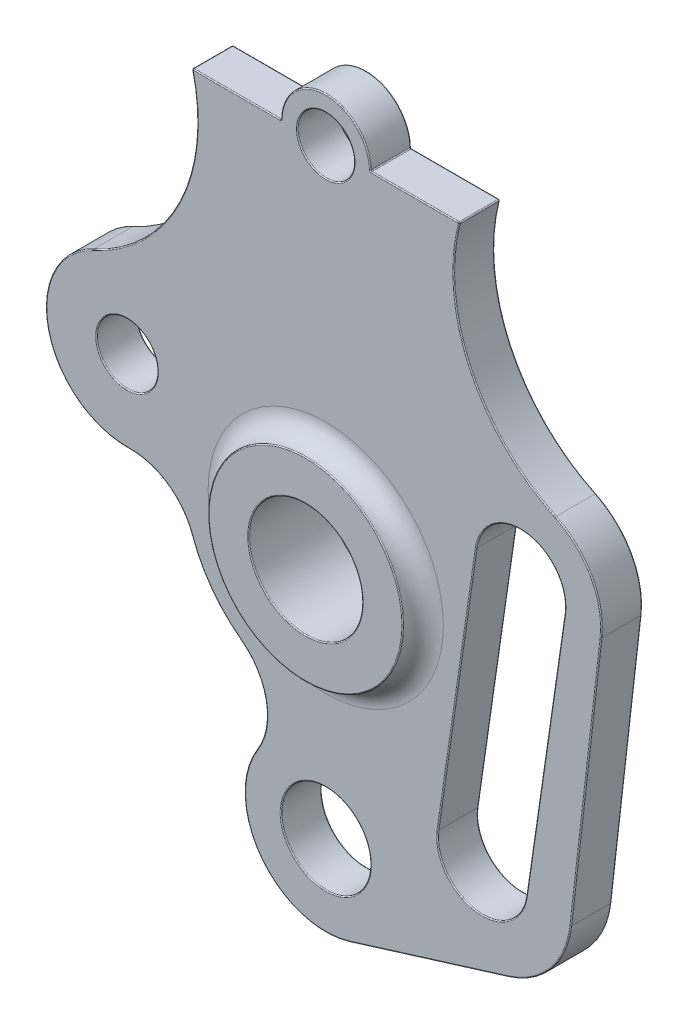
from build123d import *

# Parameters (mm, degrees)
SKETCH1_R           = 24
SKETCH1_R_2         = 14
EXTRUDE_THIN1_DEPTH = 10
SKETCH1_5_R         = 14
SKETCH1_5_R_2       = 7
SKETCH1_5_R_3       = 11
SKETCH1_5_R_4       = 7.5
BOSS_EXTRUDE2_DEPTH = 5
FILLET1_R           = 5
FILLET2_R           = 0.25


with BuildPart() as part:
    # Sketch1 → Extrude-Thin1 (new, symmetric)
    with BuildSketch(Plane.XY):
        Circle(SKETCH1_R)
        Circle(SKETCH1_R_2, mode=Mode.SUBTRACT)
    extrude(amount=EXTRUDE_THIN1_DEPTH, both=True)

    # Sketch1<5> → Boss-Extrude2 (add, symmetric)
    with BuildSketch(Plane.XY):
        with BuildLine():
            Line((60.425148575, -48.459175665), (67.870810904, 16.730446293))
            ThreePointArc((67.870810904, 16.730446293), (65.492902941, 28.695274452), (56.607129575, 37.053180342))
            ThreePointArc((56.607129575, 37.053180342), (35.620438837, 58.271422809), (33, 88))
            Line((33, 88), (11, 88))
            ThreePointArc((11, 88), (0, 99), (-11, 88))
            Line((-11, 88), (-33, 88))
            ThreePointArc((-33, 88), (-35.964324056, 58.187323214), (-57.328341378, 37.183474088))
            ThreePointArc((-57.328341378, 37.183474088), (-68.484992944, 14.490559903), (-48.492972379, -0.993572042))
            ThreePointArc((-48.492972379, -0.993572042), (-39.014510451, -3.809523143), (-33.001122743, -11.658726248))
            ThreePointArc((-33.001122743, -11.658726248), (-28.18429152, -20.752004999), (-20.931196761, -28.051470588))
            ThreePointArc((-20.931196761, -28.051470588), (-14.77228566, -37.934411824), (-16.94430214, -49.375))
            ThreePointArc((-16.94430214, -49.375), (-15.854636455, -72.191411029), (5.916450554, -79.104858357))
            Line((5.916450554, -79.104858357), (45.075352191, -66.97801078))
            ThreePointArc((45.075352191, -66.97801078), (55.505205887, -60.002106509), (60.425148575, -48.459175665))
        make_face()
        Circle(SKETCH1_5_R, mode=Mode.SUBTRACT)
        with Locations((0, 88)):
            Circle(SKETCH1_5_R_2, mode=Mode.SUBTRACT)
        with Locations((0, -60)):
            Circle(SKETCH1_5_R_3, mode=Mode.SUBTRACT)
        with Locations((-49, 19)):
            Circle(SKETCH1_5_R_4, mode=Mode.SUBTRACT)
        with BuildLine():
            ThreePointArc((27.681415305, -44.382014914), (36.986604908, -56.848507863), (49.453097857, -47.543318261))
            Line((49.453097857, -47.543318261), (58.885841276, 17.419348327))
            ThreePointArc((58.885841276, 17.419348327), (49.580651673, 29.885841276), (37.114158724, 20.580651673))
            Line((37.114158724, 20.580651673), (27.681415305, -44.382014914))
        make_face(mode=Mode.SUBTRACT)
    extrude(amount=BOSS_EXTRUDE2_DEPTH, both=True)

    # Fillet1
    fillet1_edges = [part.edges().sort_by_distance(p)[0] for p in [
        (-24, 0, -5),
        (-24, 0, 5),
    ]]
    fillet(fillet1_edges, radius=FILLET1_R - 0.0001)  # a hair under: the kernel refuses the full size

    # Fillet2
    fillet2_edges = [part.edges().sort_by_distance(p)[0] for p in [
        (64.147979739, -15.864364686, 5),
        (65.492902941, 28.695274452, 5),
        (22, 88, 5),
        (0, 99, 5),
        (-35.964324056, 58.187323214, 5),
        (-68.484992944, 14.490559903, 5),
        (-39.014510451, -3.809523143, 5),
        (-28.18429152, -20.752004999, 5),
        (-14.77228566, -37.934411824, 5),
        (-15.854636455, -72.191411029, 5),
        (25.495901372, -73.041434568, 5),
        (55.505205887, -60.002106509, 5),
        (54.169469567, -15.061984967, 5),
        (-22, 88, -5),
        (35.620438837, 58.271422809, -5),
        (36.986604908, -56.848507863, -5),
        (49.580651673, 29.885841276, -5),
        (32.397787015, -11.90068162, -5),
        (-56.5, 19, -5),
        (-11, -60, -5),
        (-7, 88, -5),
        (-24, 0, -10),
        (64.147979739, -15.864364686, -5),
        (65.492902941, 28.695274452, -5),
        (35.620438837, 58.271422809, 5),
        (22, 88, -5),
        (33, 88, 0),
        (0, 99, -5),
        (11, 88, 0),
        (-22, 88, 5),
        (-11, 88, 0),
        (-35.964324056, 58.187323214, -5),
        (-33, 88, 0),
        (-68.484992944, 14.490559903, -5),
        (-39.014510451, -3.809523143, -5),
        (-28.18429152, -20.752004999, -5),
        (-14.77228566, -37.934411824, -5),
        (-15.854636455, -72.191411029, -5),
        (25.495901372, -73.041434568, -5),
        (36.986604908, -56.848507863, 5),
        (32.397787015, -11.90068162, 5),
        (49.580651673, 29.885841276, 5),
        (54.169469567, -15.061984967, -5),
        (-56.5, 19, 5),
        (-11, -60, 5),
        (-7, 88, 5),
        (55.505205887, -60.002106509, -5),
        (-14, 0, -10),
        (-24, 0, 10),
        (-14, 0, 10),
    ]]
    fillet(fillet2_edges, radius=FILLET2_R)


solid = part.part
